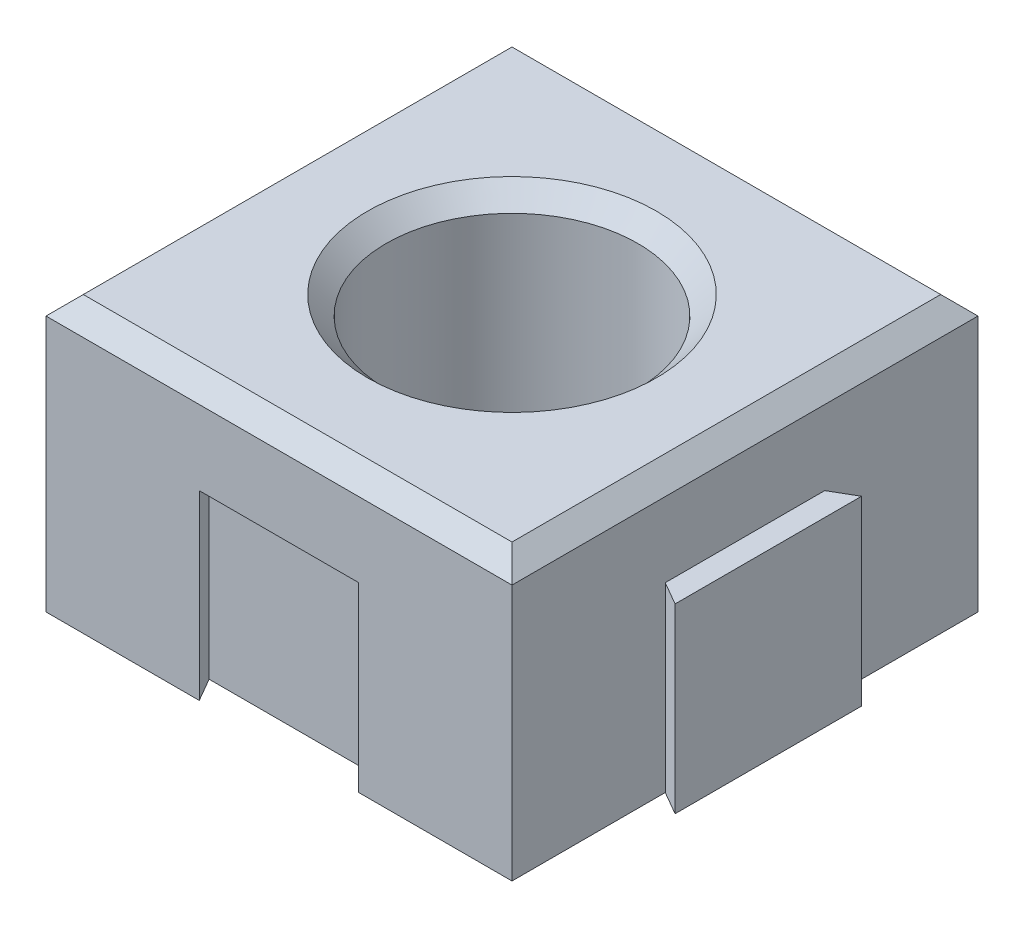
from build123d import *

# Parameters (mm, degrees)
SKETCH1_W           = 50
SKETCH1_H           = 50
BOSS_EXTRUDE1_DEPTH = 30
SKETCH2_R           = 13.5
CUT_EXTRUDE1_DEPTH  = 26
BOSS_EXTRUDE2_DEPTH = 20
BOSS_EXTRUDE3_DEPTH = 20
CUT_EXTRUDE2_DEPTH  = 20
CUT_EXTRUDE3_DEPTH  = 20
CHAMFER1_SIZE       = 2
SKETCH4_R           = 3.1
CUT_EXTRUDE4_DEPTH  = 4
CHAMFER2_SIZE       = 1
CHAMFER3_SIZE       = 0.5


with BuildPart() as part:
    # Sketch1 → Boss-Extrude1 (new body)
    with BuildSketch(Plane(origin=(0, 0, 0), x_dir=(1, 0, 0), z_dir=(0, 1, 0))):
        with Locations((25, 25)):
            Rectangle(SKETCH1_W, SKETCH1_H)
    extrude(amount=BOSS_EXTRUDE1_DEPTH)

    # Sketch2 → Cut-Extrude1 (cut)
    with BuildSketch(Plane(origin=(0, 30, 0), x_dir=(1, 0, 0), z_dir=(0, 1, 0))):
        with Locations((25, 25)):
            Circle(SKETCH2_R)
    extrude(amount=-CUT_EXTRUDE1_DEPTH, mode=Mode.SUBTRACT)

    # Sketch3 → Boss-Extrude2 (add)
    with BuildSketch(Plane(origin=(0, 0, 0), x_dir=(1, 0, 0), z_dir=(0, 1, 0))):
        Polygon((50, 33.556624327), (52.5, 35), (52.5, 15), (50, 16.443375673), align=None)
    extrude(amount=BOSS_EXTRUDE2_DEPTH)

    # Sketch3<3> → Boss-Extrude3 (add)
    with BuildSketch(Plane(origin=(0, 0, 0), x_dir=(1, 0, 0), z_dir=(0, 1, 0))):
        Polygon((16.443375673, 50), (15, 52.5), (35, 52.5), (33.556624327, 50), align=None)
    extrude(amount=BOSS_EXTRUDE3_DEPTH)

    # Sketch3<4> → Cut-Extrude2 (cut)
    with BuildSketch(Plane(origin=(0, 0, 0), x_dir=(1, 0, 0), z_dir=(0, 1, 0))):
        Polygon((0, 33.556624327), (2.5, 35), (2.5, 15), (0, 16.443375673), align=None)
    extrude(amount=CUT_EXTRUDE2_DEPTH, mode=Mode.SUBTRACT)

    # Sketch3<5> → Cut-Extrude3 (cut)
    with BuildSketch(Plane(origin=(0, 0, 0), x_dir=(1, 0, 0), z_dir=(0, 1, 0))):
        Polygon((16.443375673, 0), (15, 2.5), (35, 2.5), (33.556624327, 0), align=None)
    extrude(amount=CUT_EXTRUDE3_DEPTH, mode=Mode.SUBTRACT)

    # Chamfer1
    chamfer1_edges = [part.edges().sort_by_distance(p)[0] for p in [
        (25, 30, -50),
        (50, 30, -25),
        (25, 30, 0),
        (0, 30, -25),
        (11.5, 30, -25),
    ]]
    chamfer(chamfer1_edges, length=CHAMFER1_SIZE)

    # Sketch4 → Cut-Extrude4 (cut)
    with BuildSketch(Plane(origin=(0, 0, 0), x_dir=(1, 0, 0), z_dir=(0, 1, 0))):
        with Locations((12.5, 37.5)):
            Circle(SKETCH4_R)
        with Locations((37.5, 37.5)):
            Circle(SKETCH4_R)
        with Locations((37.5, 12.5)):
            Circle(SKETCH4_R)
        with Locations((12.5, 12.5)):
            Circle(SKETCH4_R)
    extrude(amount=CUT_EXTRUDE4_DEPTH, mode=Mode.SUBTRACT)

    # Chamfer2
    chamfer2_edges = [part.edges().sort_by_distance(p)[0] for p in [
        (34.4, 4, -12.5),
        (9.4, 4, -12.5),
        (9.4, 4, -37.5),
        (34.4, 4, -37.5),
    ]]
    chamfer(chamfer2_edges, length=CHAMFER2_SIZE)

    # Chamfer3
    chamfer3_edges = [part.edges().sort_by_distance(p)[0] for p in [
        (25, 0, -2.5),
        (34.278312164, 0, -1.25),
        (41.778312164, 0, 0),
        (50, 0, -8.221687836),
        (51.25, 0, -15.721687836),
        (52.5, 0, -25),
        (51.25, 0, -34.278312164),
        (50, 0, -41.778312164),
        (41.778312164, 0, -50),
        (34.278312164, 0, -51.25),
        (25, 0, -52.5),
        (15.721687836, 0, -51.25),
        (8.221687836, 0, -50),
        (0, 0, -41.778312164),
        (1.25, 0, -34.278312164),
        (2.5, 0, -25),
        (1.25, 0, -15.721687836),
        (0, 0, -8.221687836),
        (8.221687836, 0, 0),
        (15.721687836, 0, -1.25),
        (9.4, 0, -37.5),
        (34.4, 0, -37.5),
        (34.4, 0, -12.5),
        (9.4, 0, -12.5),
    ]]
    chamfer(chamfer3_edges, length=CHAMFER3_SIZE)


solid = part.part
